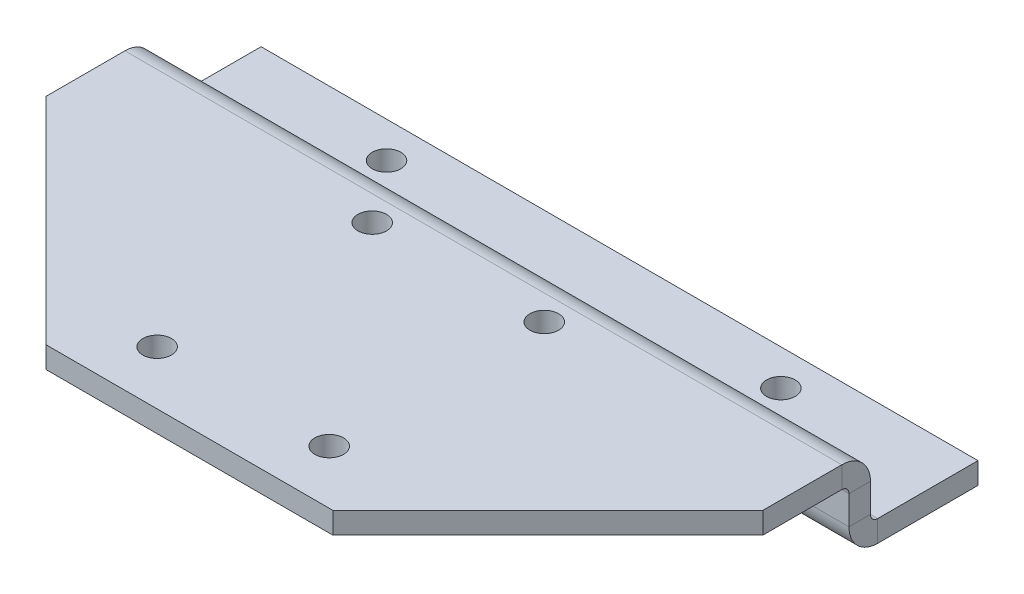
from build123d import *

# Parameters (mm, degrees)
SKETCH1_W                    = 100
SKETCH1_H                    = 45
BASE_FLANGE1_DEPTH           = 3
EDGE_FLANGE1_STRIP_W         = 14
EDGE_FLANGE1_STRIP_H         = 3
EDGE_FLANGE1_STRIP_CUT_DEPTH = 100
EDGE_FLANGE1_DEPTH           = 100
EDGE_FLANGE2_STRIP_W         = 14
EDGE_FLANGE2_STRIP_H         = 3
EDGE_FLANGE2_STRIP_CUT_DEPTH = 100
EDGE_FLANGE2_DEPTH           = 100
SKETCH12_R                   = 2
CUT_EXTRUDE1_DEPTH           = 64.144675152
F_4_0MM_DOWEL_HOLE1_D        = 4
F_4_0MM_DOWEL_HOLE1_DEPTH    = 12.4
F_4_0MM_DOWEL_HOLE1_TIP      = 1.201721238
CHAMFER1_SIZE                = 30


# Sheet-metal steps are written as plain solids
with BuildPart() as part:
    # Sketch1 → Base-Flange1 (new body)
    with BuildSketch(Plane(origin=(0, 0, 0), x_dir=(1, 0, 0), z_dir=(0, 1, 0))):
        Rectangle(SKETCH1_W, SKETCH1_H)
    extrude(amount=-BASE_FLANGE1_DEPTH)

    # Edge-Flange1 strip (across the edge) → Edge-Flange1 strip cut (cut)
    with BuildSketch(Plane(origin=(-50, -3, -22.5), x_dir=(0, 0, 1), z_dir=(1, 0, 0))):
        with Locations((-3, -1.5)):
            Rectangle(EDGE_FLANGE1_STRIP_W, EDGE_FLANGE1_STRIP_H)
    extrude(amount=EDGE_FLANGE1_STRIP_CUT_DEPTH, mode=Mode.SUBTRACT)

    # Edge-Flange1 section (across the edge) → Edge-Flange1 (add)
    with BuildSketch(Plane(origin=(-50, -3, -22.5), x_dir=(0, 0, 1), z_dir=(1, 0, 0))):
        with BuildLine():
            Line((0, 1), (0, 9))
            Line((0, 9), (3, 9))
            Line((3, 9), (3, 1))
            ThreePointArc((3, 1), (3.292893219, 0.292893219), (4, 0))
            Line((4, 0), (4, -3))
            ThreePointArc((4, -3), (1.171572875, -1.828427125), (0, 1))
        make_face()
    extrude(amount=EDGE_FLANGE1_DEPTH)

    # Edge-Flange2 strip (across the edge) → Edge-Flange2 strip cut (cut)
    with BuildSketch(Plane(origin=(50, -12, -22.5), x_dir=(0, 1, 0), z_dir=(-1, 0, 0))):
        with Locations((-3, -1.5)):
            Rectangle(EDGE_FLANGE2_STRIP_W, EDGE_FLANGE2_STRIP_H)
    extrude(amount=EDGE_FLANGE2_STRIP_CUT_DEPTH, mode=Mode.SUBTRACT)

    # Edge-Flange2 section (across the edge) → Edge-Flange2 (add)
    with BuildSketch(Plane(origin=(50, -12, -22.5), x_dir=(0, 1, 0), z_dir=(-1, 0, 0))):
        with BuildLine():
            Line((0, 1), (0, 15))
            Line((0, 15), (3, 15))
            Line((3, 15), (3, 1))
            ThreePointArc((3, 1), (3.292893219, 0.292893219), (4, 0))
            Line((4, 0), (4, -3))
            ThreePointArc((4, -3), (1.171572875, -1.828427125), (0, 1))
        make_face()
    extrude(amount=EDGE_FLANGE2_DEPTH)

    # Sketch12 → Cut-Extrude1 (cut, through all)
    with BuildSketch(Plane(origin=(0, -9, 0), x_dir=(1, 0, 0), z_dir=(0, 1, 0))):
        with Locations(Location((-27.5, 32.5, 0), (0, 0, 270))):
            Circle(SKETCH12_R)
        with Locations(Location((27.5, 32.5, 0), (0, 0, 270))):
            Circle(SKETCH12_R)
    extrude(amount=-CUT_EXTRUDE1_DEPTH, mode=Mode.SUBTRACT)

    # Ø4.0mm Dowel Hole1
    with Locations(Plane(origin=(12, 0, -15), x_dir=(0, 0, 1), z_dir=(0, 1, 0))):
        with Locations((0, 0), (30, 0), (30, -24), (0, -24)):
            Hole(F_4_0MM_DOWEL_HOLE1_D / 2, depth=F_4_0MM_DOWEL_HOLE1_DEPTH)
            with Locations((0, 0, -(F_4_0MM_DOWEL_HOLE1_DEPTH + F_4_0MM_DOWEL_HOLE1_TIP / 2))):  # 118° drill point
                Cone(0, F_4_0MM_DOWEL_HOLE1_D / 2, F_4_0MM_DOWEL_HOLE1_TIP, mode=Mode.SUBTRACT)

    # Chamfer1
    chamfer1_edges = [part.edges().sort_by_distance(p)[0] for p in [
        (50, -1.5, 22.5),
        (-50, -1.5, 22.5),
    ]]
    chamfer(chamfer1_edges, length=CHAMFER1_SIZE)


solid = part.part
